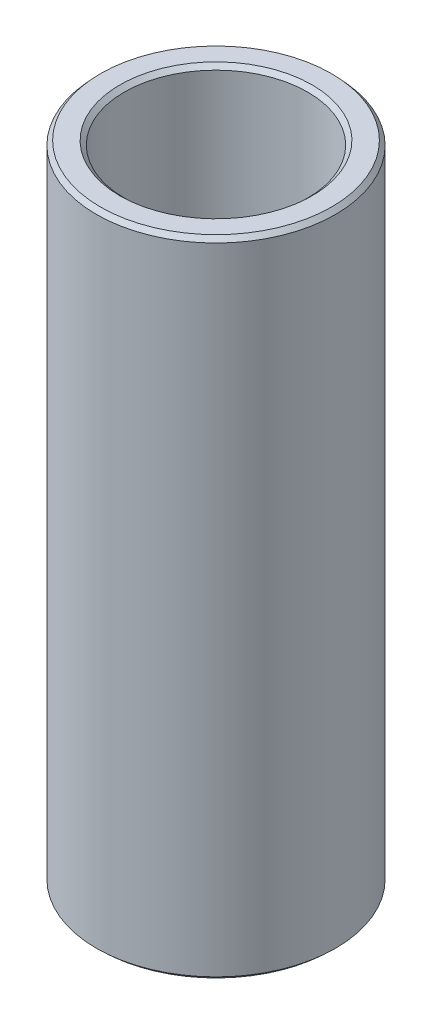
from build123d import *
from OCP.BRepFilletAPI import BRepFilletAPI_MakeChamfer

# Parameters (mm, degrees)
SKETCH1_R           = 27.5
BOSS_EXTRUDE1_DEPTH = 148.090437765
SKETCH2_R           = 21.093940495
CUT_EXTRUDE1_DEPTH  = 154.111977838
CHAMFER1_SIZE       = 1.01126568
CHAMFER1_SIZE2      = 0.931218711


with BuildPart() as part:
    # Sketch1 → Boss-Extrude1 (new body)
    with BuildSketch(Plane(origin=(0, 0, 0), x_dir=(1, 0, 0), z_dir=(0, 1, 0))):
        Circle(SKETCH1_R)
    extrude(amount=BOSS_EXTRUDE1_DEPTH)

    # Sketch2 → Cut-Extrude1 (cut, through all)
    with BuildSketch(Plane(origin=(0, 0, 0), x_dir=(1, 0, 0), z_dir=(0, 1, 0))):
        Circle(SKETCH2_R)
    extrude(amount=CUT_EXTRUDE1_DEPTH, mode=Mode.SUBTRACT)

    # Chamfer1: one chamfer whose edges measure the first distance from different faces: ONE call of the kernel's chamfer builder (chamfer() names one face for all edges)
    chamfer1_edges_1 = [part.edges().sort_by_distance(p)[0] for p in [
        (-21.093940495, 148.090437765, 0),
    ]]
    chamfer1_side_1 = [part.faces().sort_by_distance(p)[0] for p in [
        (-26.722182541, 148.090437765, 0),
    ]]
    chamfer1_edges_2 = [part.edges().sort_by_distance(p)[0] for p in [
        (-21.093940495, 0, 0),
    ]]
    chamfer1_side_2 = [part.faces().sort_by_distance(p)[0] for p in [
        (-21.093940495, 74.045218883, 0),
    ]]
    chamfer1_edges_3 = [part.edges().sort_by_distance(p)[0] for p in [
        (-27.5, 0, 0),
    ]]
    chamfer1_side_3 = [part.faces().sort_by_distance(p)[0] for p in [
        (-26.722182541, 0, 0),
    ]]
    chamfer1_edges_4 = [part.edges().sort_by_distance(p)[0] for p in [
        (-27.5, 148.090437765, 0),
    ]]
    chamfer1_side_4 = [part.faces().sort_by_distance(p)[0] for p in [
        (-27.5, 74.045218883, 0),
    ]]
    chamfer1 = BRepFilletAPI_MakeChamfer(part.part.solid().wrapped)
    for e in chamfer1_edges_1:
        chamfer1.Add(CHAMFER1_SIZE, CHAMFER1_SIZE2, e.wrapped, chamfer1_side_1[0].wrapped)  # the first distance lies on this face
    for e in chamfer1_edges_2:
        chamfer1.Add(CHAMFER1_SIZE, CHAMFER1_SIZE2, e.wrapped, chamfer1_side_2[0].wrapped)  # the first distance lies on this face
    for e in chamfer1_edges_3:
        chamfer1.Add(CHAMFER1_SIZE, CHAMFER1_SIZE2, e.wrapped, chamfer1_side_3[0].wrapped)  # the first distance lies on this face
    for e in chamfer1_edges_4:
        chamfer1.Add(CHAMFER1_SIZE, CHAMFER1_SIZE2, e.wrapped, chamfer1_side_4[0].wrapped)  # the first distance lies on this face
    add(Compound.cast(chamfer1.Shape()), mode=Mode.REPLACE)


solid = part.part
